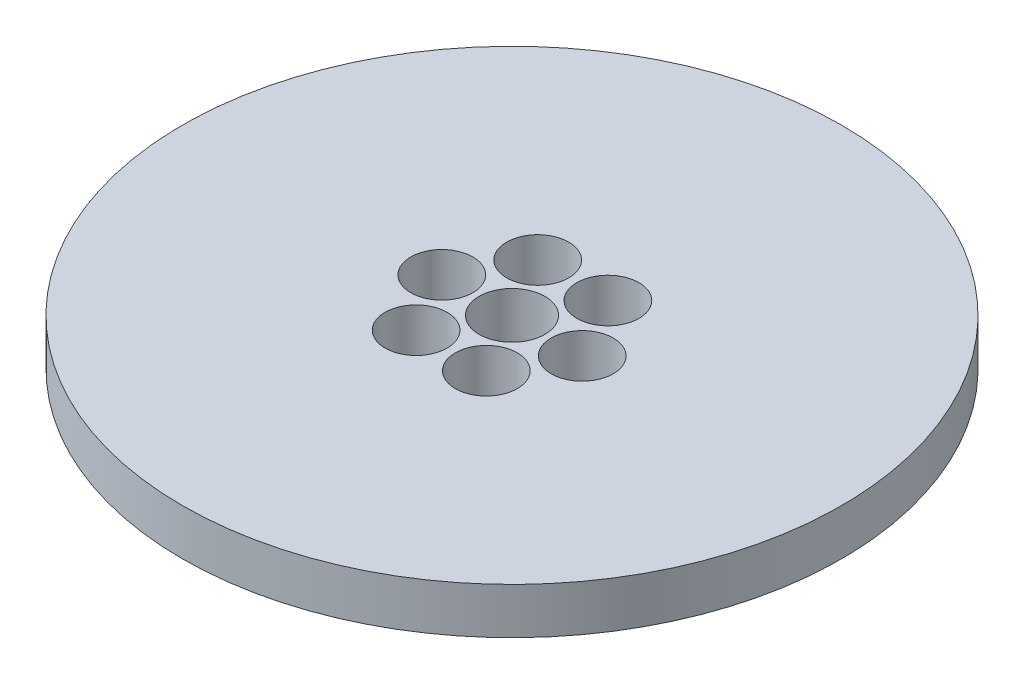
from build123d import *

# Parameters (mm, degrees)
SKETCH1_R           = 50
BOSS_EXTRUDE1_DEPTH = 7
SKETCH2_R           = 5
CUT_EXTRUDE1_DEPTH  = 72.056315694
SKETCH3_R           = 4.707321815
CUT_EXTRUDE2_DEPTH  = 6.731336382
CIRPATTERN1_COUNT   = 6


with BuildPart() as part:
    # Sketch1 → Boss-Extrude1 (new body)
    with BuildSketch(Plane(origin=(0, 0, 0), x_dir=(1, 0, 0), z_dir=(0, 1, 0))):
        Circle(SKETCH1_R)
    extrude(amount=BOSS_EXTRUDE1_DEPTH)

    # Sketch2 → Cut-Extrude1 (cut, through all)
    with BuildSketch(Plane(origin=(0, 0, 0), x_dir=(1, 0, 0), z_dir=(0, 1, 0))):
        Circle(SKETCH2_R)
    extrude(amount=CUT_EXTRUDE1_DEPTH, mode=Mode.SUBTRACT)

    # Sketch3 → Cut-Extrude2 (cut)
    with BuildSketch(Plane(origin=(0, 7, 0), x_dir=(1, 0, 0), z_dir=(0, 1, 0))):
        with Locations((-10.650628421, 0)):
            Circle(SKETCH3_R)
    cut_extrude2 = extrude(amount=-CUT_EXTRUDE2_DEPTH, mode=Mode.SUBTRACT)

    # CirPattern1: Cut-Extrude2 ×6 about axis
    cirpattern1_axis = Axis((0, 0, 0), (0, 1, 0))
    for i in range(1, CIRPATTERN1_COUNT):
        add(cut_extrude2.rotate(cirpattern1_axis, i * 360 / CIRPATTERN1_COUNT), mode=Mode.SUBTRACT)


solid = part.part
